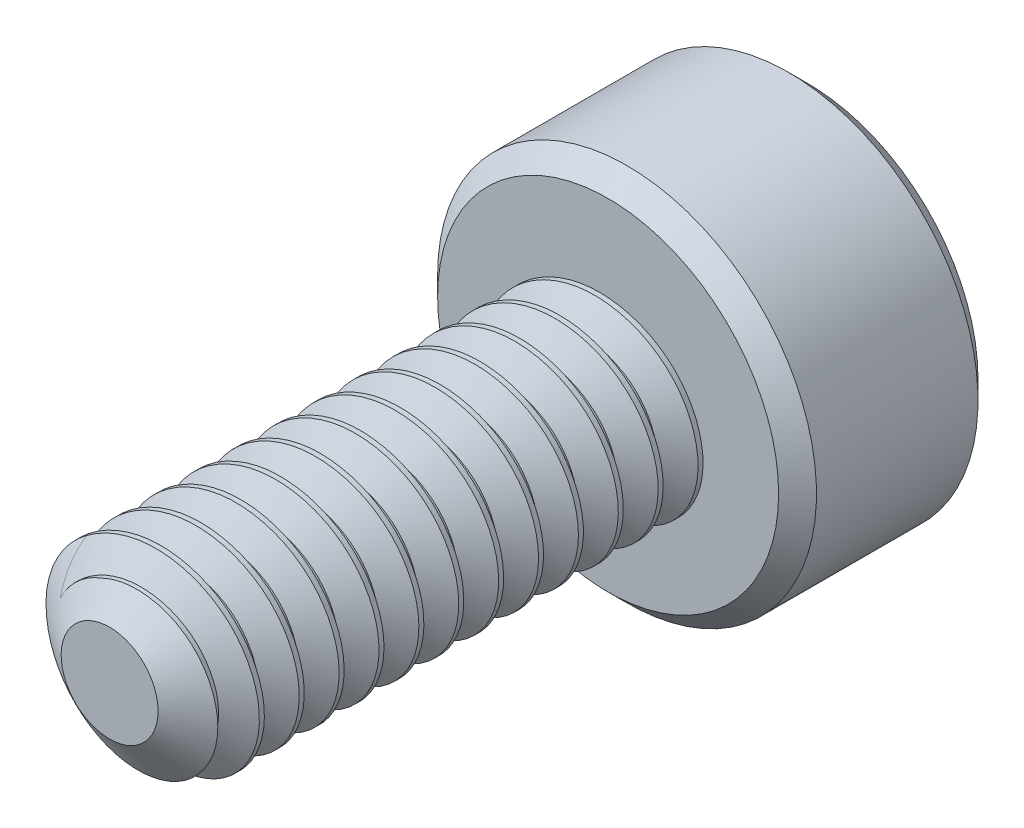
from build123d import *

# Parameters (mm, degrees)
SKETCH1_R          = 1
EXTRUDE1_DEPTH     = 5
CUT_SWEEP1_PITCH   = 0.4
SKETCH6_R          = 1.9
EXTRUDE2_DEPTH     = 2
CUT_EXTRUDE1_DEPTH = 1.125
CHAMFER1_SIZE      = 0.19


with BuildPart() as part:
    # Sketch1 → Extrude1 (new body)
    with BuildSketch(Plane.XY):
        Circle(SKETCH1_R)
    extrude(amount=-EXTRUDE1_DEPTH)

    # Cut-Sweep1: the profile of Sketch3 profile screwed along a right-hand helix of 13.5 turns, 6 arcs to a turn; built about Z, then put on its axis
    cut_sweep1_z = Axis((0, 0, 0), (0, 0, 1))
    cut_sweep1_corners = [(1.0003, 0, -0.350173205), (0.740192379, 0, -0.2), (0.740192379, 0, -0.15), (1.0003, 0, 0.000173205)]
    with BuildLine(mode=Mode.PRIVATE) as cut_sweep1_profile:
        Line(cut_sweep1_corners[0], cut_sweep1_corners[1])
        Line(cut_sweep1_corners[1], cut_sweep1_corners[2])
        Line(cut_sweep1_corners[2], cut_sweep1_corners[3])
        Line(cut_sweep1_corners[3], cut_sweep1_corners[0])
    cut_sweep1_cap = Face(cut_sweep1_profile.wire())
    cut_sweep1_turn_angles = [0, 30, 60, 90, 120, 150, 180, 210, 240, 270, 300, 330, 360]
    cut_sweep1_turn_weights = [1, 0.8660254037844387, 1, 0.8660254037844387, 1, 0.8660254037844387, 1, 0.8660254037844387, 1, 0.8660254037844387, 1, 0.8660254037844387, 1]
    cut_sweep1_turn_rails = [Edge.make_bspline([Vector(p[0], p[1], 0).rotate(cut_sweep1_z, cut_sweep1_turn_angles[k]) / cut_sweep1_turn_weights[k] + Vector(0, 0, p[2] + CUT_SWEEP1_PITCH * cut_sweep1_turn_angles[k] / 360) for k in range(13)], [0, 0, 0, 1, 1, 2, 2, 3, 3, 4, 4, 5, 5, 6, 6, 6], 2, cut_sweep1_turn_weights) for p in cut_sweep1_corners]
    cut_sweep1_turn_sides = [Face.make_surface_from_curves(cut_sweep1_turn_rails[p[0]], cut_sweep1_turn_rails[p[1]]) for p in [(0, 1), (1, 2), (2, 3), (3, 0)]]
    cut_sweep1_last_angles = [4680, 4710, 4740, 4770, 4800, 4830, 4860]
    cut_sweep1_last_weights = [1, 0.8660254037844387, 1, 0.8660254037844387, 1, 0.8660254037844347, 1]
    cut_sweep1_last_rails = [Edge.make_bspline([Vector(p[0], p[1], 0).rotate(cut_sweep1_z, cut_sweep1_last_angles[k]) / cut_sweep1_last_weights[k] + Vector(0, 0, p[2] + CUT_SWEEP1_PITCH * cut_sweep1_last_angles[k] / 360) for k in range(7)], [0, 0, 0, 1, 1, 2, 2, 3, 3, 3], 2, cut_sweep1_last_weights) for p in cut_sweep1_corners]
    cut_sweep1_last_sides = [Face.make_surface_from_curves(cut_sweep1_last_rails[p[0]], cut_sweep1_last_rails[p[1]]) for p in [(0, 1), (1, 2), (2, 3), (3, 0)]]
    cut_sweep1 = Plane(origin=(0, 0, 0), x_dir=(0, 1, 0), z_dir=(0, 0, -1)) * Solid(Shell([*[p.moved(Location((0, 0, CUT_SWEEP1_PITCH * i))) for i in range(13) for p in cut_sweep1_turn_sides], *cut_sweep1_last_sides, cut_sweep1_cap, cut_sweep1_cap.rotate(cut_sweep1_z, 4860).moved(Location((0, 0, CUT_SWEEP1_PITCH * 4860 / 360)))]))
    add(cut_sweep1, mode=Mode.SUBTRACT)

    # Sketch4 → Cut-Revolve1 (revolve, cut)
    with BuildSketch(Plane(origin=(0, 0, 0), x_dir=(0, 0, -1), z_dir=(1, 0, 0)), mode=Mode.PRIVATE) as cut_revolve1_sk:
        Polygon((0.35977197, 1), (0, 0.486192379), (0, 1), align=None)
    revolve(cut_revolve1_sk.sketch.rotate(Axis((0, 0, 0), (0, 0, -1)), 278.428757719), axis=Axis((0, 0, 0), (0, 0, -1)), mode=Mode.SUBTRACT)

    # Sketch6 → Extrude2 (add)
    with BuildSketch(Plane(origin=(0, 0, -5), x_dir=(-1, 0, 0), z_dir=(0, 0, -1))):
        Circle(SKETCH6_R)
    extrude(amount=EXTRUDE2_DEPTH)

    # Sketch7 → Cut-Extrude1 (cut)
    with BuildSketch(Plane(origin=(0, 0, -7), x_dir=(-1, 0, 0), z_dir=(0, 0, -1))):
        Polygon((0, 0.866025404), (-0.75, 0.433012702), (-0.75, -0.433012702), (0, -0.866025404), (0.75, -0.433012702), (0.75, 0.433012702), align=None)
    extrude(amount=-CUT_EXTRUDE1_DEPTH, mode=Mode.SUBTRACT)

    # Cut-Extrude2 cone 1 section (through the dimple's axis) → Cut-Extrude2 (revolve, cut)
    with BuildSketch(Plane(origin=(0, 0, -7), x_dir=(0, 1, 0), z_dir=(1, 0, 0))):
        Polygon((0, 0), (0.866025404, 0), (0, 0.866025404), align=None)
    revolve(axis=Axis((0, 0, -7), (0, 0, 1)), mode=Mode.SUBTRACT)

    # Chamfer1
    chamfer1_edges = [part.edges().sort_by_distance(p)[0] for p in [
        (1.9, 0, -5),
        (1.9, 0, -7),
    ]]
    chamfer(chamfer1_edges, length=CHAMFER1_SIZE)


solid = part.part
